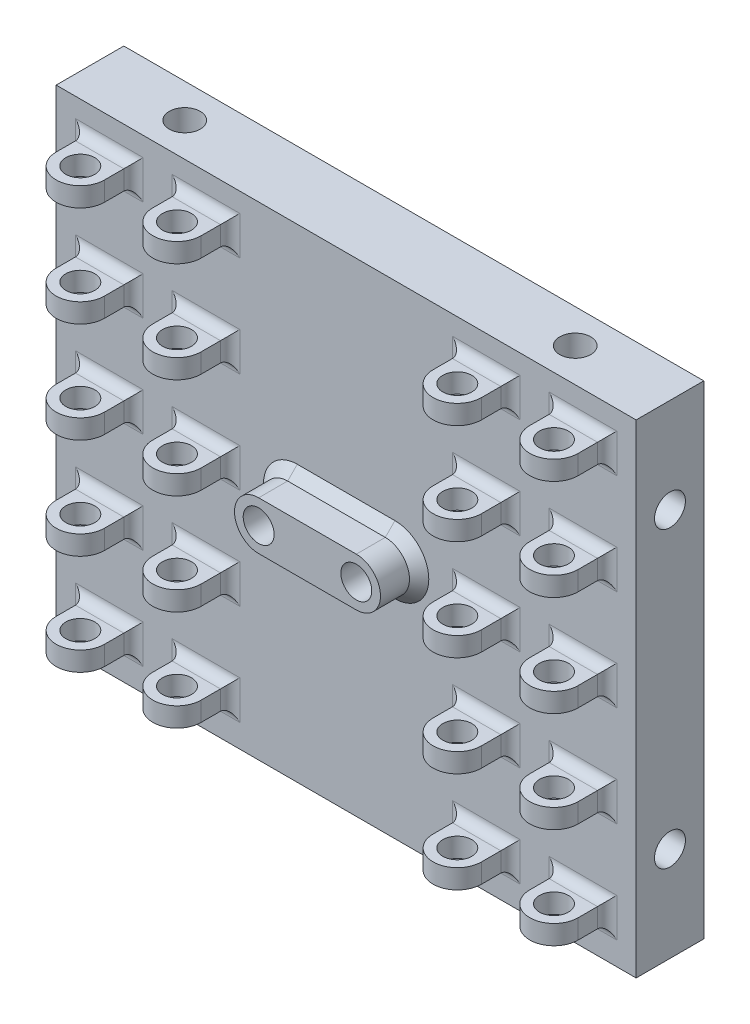
from build123d import *

# Parameters (mm, degrees)
SKETCH1_W               = 60
SKETCH1_H               = 50
BOSS_EXTRUDE1_DEPTH     = 7
BOSS_EXTRUDE2_DEPTH     = 4
SKETCH3_R               = 1.6
CUT_EXTRUDE1_DEPTH      = 41.57092555
CHAMFER1_SIZE           = 1
CUT_EXTRUDE2_DEPTH      = 4
SKETCH5_W               = 2.5
SKETCH5_H               = 5.6
CUT_EXTRUDE3_DEPTH      = 6.4
CUT_EXTRUDE4_START      = -6.4
SKETCH6_R               = 1.6
CUT_EXTRUDE4_DEPTH      = 11.4
MIRROR5_COPY_1_SKETCH_W = 2.5
MIRROR5_COPY_1_SKETCH_H = 5.6
MIRROR5_COPY_1_DEPTH    = 6.4
MIRROR5_START           = -6.4
MIRROR5_COPY_2_SKETCH_R = 1.6
MIRROR5_COPY_2_DEPTH    = 11.4
MIRROR6_START           = 20
MIRROR6_OUTLINE_W       = 5.6
MIRROR6_OUTLINE_H       = 6.4
MIRROR6_DEPTH           = 2.5
MIRROR6_START_2         = 17.5
MIRROR6_2_OUTLINE_R     = 1.6
MIRROR6_2_DEPTH         = 7.5
MIRROR6_START_3         = -27.5
MIRROR6_3_OUTLINE_W     = 5.6
MIRROR6_3_OUTLINE_H     = 6.4
MIRROR6_3_DEPTH         = 2.5
MIRROR6_START_4         = -30
MIRROR6_4_OUTLINE_R     = 1.6
MIRROR6_4_DEPTH         = 7.5
BOSS_EXTRUDE3_START     = -3
SKETCH7_R               = 1.5
BOSS_EXTRUDE3_DEPTH     = 2
FILLET1_R               = 1
LPATTERN1_COUNT         = 5
LPATTERN1_PITCH         = 10.4
LPATTERN1_COUNT_DIR2    = 2
LPATTERN1_PITCH_DIR2    = 10
FILLET1_OF_LPATTERN1_R  = 1
BOSS_EXTRUDE4_START     = -0.2
SKETCH8_R               = 1.6
BOSS_EXTRUDE4_DEPTH     = 0.2


# Read off the part's stored shape, not the designer's step: Mirror6, Mirror8
with BuildPart() as part:
    # Sketch1 → Boss-Extrude1 (new body)
    with BuildSketch(Plane.XY):
        Rectangle(SKETCH1_W, SKETCH1_H)
    extrude(amount=BOSS_EXTRUDE1_DEPTH)

    # Sketch2 → Boss-Extrude2 (add)
    with BuildSketch(Plane.XY.offset(7)):
        with BuildLine():
            Line((-5.05, 2.5), (5.05, 2.5))
            ThreePointArc((5.05, 2.5), (7.55, 0), (5.05, -2.5))
            Line((5.05, -2.5), (-5.05, -2.5))
            ThreePointArc((-5.05, -2.5), (-7.55, 0), (-5.05, 2.5))
        make_face()
    extrude(amount=BOSS_EXTRUDE2_DEPTH)

    # Sketch3 → Cut-Extrude1 (cut, through all)
    with BuildSketch(Plane.XY.offset(11)):
        with Locations((-5.05, 0)):
            Circle(SKETCH3_R)
        with Locations((5.05, 0)):
            Circle(SKETCH3_R)
    extrude(amount=-CUT_EXTRUDE1_DEPTH, mode=Mode.SUBTRACT)

    # Chamfer1
    chamfer1_edges = [part.edges().sort_by_distance(p)[0] for p in [
        (-7.55, 0, 7),
        (0, -2.5, 7),
        (7.55, 0, 7),
        (0, 2.5, 7),
    ]]
    chamfer(chamfer1_edges, length=CHAMFER1_SIZE)

    # Sketch4 → Cut-Extrude2 (cut)
    with BuildSketch(Plane(origin=(0, 0, 0), x_dir=(-1, 0, 0), z_dir=(0, 0, -1))):
        Polygon((-1.816838493, 0), (-3.433419246, 2.8), (-6.666580754, 2.8), (-8.283161507, 0), (-6.666580754, -2.8), (-3.433419246, -2.8), align=None)
        Polygon((1.816838493, 0), (3.433419246, -2.8), (6.666580754, -2.8), (8.283161507, 0), (6.666580754, 2.8), (3.433419246, 2.8), align=None)
    extrude(amount=-CUT_EXTRUDE2_DEPTH, mode=Mode.SUBTRACT)

    # Sketch5 → Cut-Extrude3 (cut)
    with BuildSketch(Plane(origin=(0, 0, 0), x_dir=(-1, 0, 0), z_dir=(0, 0, -1))):
        with Locations((-26.25, -15.2)):
            Rectangle(SKETCH5_W, SKETCH5_H)
    cut_extrude3 = extrude(amount=-CUT_EXTRUDE3_DEPTH, mode=Mode.SUBTRACT)

    # Sketch6 → Cut-Extrude4 (cut)
    with BuildSketch(Plane.ZY.offset(-27.5).offset(CUT_EXTRUDE4_START)):
        with Locations((3.5, -15.2)):
            Circle(SKETCH6_R)
    cut_extrude4 = extrude(amount=CUT_EXTRUDE4_DEPTH, mode=Mode.SUBTRACT)

    # Mirror1: Cut-Extrude3, Cut-Extrude4 across plane
    add(cut_extrude3.mirror(Plane.ZX), mode=Mode.SUBTRACT)
    add(cut_extrude4.mirror(Plane.ZX), mode=Mode.SUBTRACT)

    # Mirror4: Cut-Extrude3, Cut-Extrude4 across plane
    add(cut_extrude3.mirror(Plane(origin=(2.5, 2.5, 0), x_dir=(0, 0, 1), z_dir=(-0.7071067811865475, -0.7071067811865477, 0))), mode=Mode.SUBTRACT)
    add(cut_extrude4.mirror(Plane(origin=(2.5, 2.5, 0), x_dir=(0, 0, 1), z_dir=(-0.7071067811865475, -0.7071067811865477, 0))), mode=Mode.SUBTRACT)

    # Mirror5: Cut-Extrude3, Cut-Extrude4 across plane
    add(cut_extrude3.mirror(Plane(origin=(0, 0, 0), x_dir=(0, 0, 1), z_dir=(1, 0, 0))), mode=Mode.SUBTRACT)
    add(cut_extrude4.mirror(Plane(origin=(0, 0, 0), x_dir=(0, 0, 1), z_dir=(1, 0, 0))), mode=Mode.SUBTRACT)

    # Mirror5 copy 1 sketch → Mirror5 copy 1 (cut)
    with BuildSketch(Plane(origin=(-5, 5, 0), x_dir=(0, 1, 0), z_dir=(0, 0, -1))):
        with Locations((-26.25, -15.2)):
            Rectangle(MIRROR5_COPY_1_SKETCH_W, MIRROR5_COPY_1_SKETCH_H)
    extrude(amount=-MIRROR5_COPY_1_DEPTH, mode=Mode.SUBTRACT)

    # Mirror5 copy 2 sketch → Mirror5 copy 2 (cut)
    with BuildSketch(Plane(origin=(-5, -22.5, 0), x_dir=(0, 0, 1), z_dir=(0, 1, 0)).offset(MIRROR5_START)):
        with Locations((3.5, -15.2)):
            Circle(MIRROR5_COPY_2_SKETCH_R)
    extrude(amount=MIRROR5_COPY_2_DEPTH, mode=Mode.SUBTRACT)

    # Mirror6 outline → Mirror6 (cut)
    with BuildSketch(Plane(origin=(0, 0, 0), x_dir=(1, 0, 0), z_dir=(0, 1, 0)).offset(MIRROR6_START)):
        with Locations((20.2, -3.2)):
            Rectangle(MIRROR6_OUTLINE_W, MIRROR6_OUTLINE_H)
    mirror6 = extrude(amount=MIRROR6_DEPTH, mode=Mode.SUBTRACT)

    # Mirror6 2 outline → Mirror6 2 (cut)
    with BuildSketch(Plane(origin=(0, 0, 0), x_dir=(1, 0, 0), z_dir=(0, 1, 0)).offset(MIRROR6_START_2)):
        with Locations((20.2, -3.5)):
            Circle(MIRROR6_2_OUTLINE_R)
    mirror6_2 = extrude(amount=MIRROR6_2_DEPTH, mode=Mode.SUBTRACT)

    # Mirror6 3 outline → Mirror6 3 (cut)
    with BuildSketch(Plane.YZ.offset(MIRROR6_START_3)):
        with Locations((15.2, 3.2)):
            Rectangle(MIRROR6_3_OUTLINE_W, MIRROR6_3_OUTLINE_H)
    mirror6_3 = extrude(amount=MIRROR6_3_DEPTH, mode=Mode.SUBTRACT)

    # Mirror6 4 outline → Mirror6 4 (cut)
    with BuildSketch(Plane.YZ.offset(MIRROR6_START_4)):
        with Locations((15.2, 3.5)):
            Circle(MIRROR6_4_OUTLINE_R)
    mirror6_4 = extrude(amount=MIRROR6_4_DEPTH, mode=Mode.SUBTRACT)

    # Mirror7: Mirror6, Mirror6 2, Mirror6 3, Mirror6 4 across plane
    add(mirror6.mirror(Plane(origin=(0, 0, 0), x_dir=(0, 0, 1), z_dir=(1, 0, 0))), mode=Mode.SUBTRACT)
    add(mirror6_2.mirror(Plane(origin=(0, 0, 0), x_dir=(0, 0, 1), z_dir=(1, 0, 0))), mode=Mode.SUBTRACT)
    add(mirror6_3.mirror(Plane(origin=(0, 0, 0), x_dir=(0, 0, 1), z_dir=(1, 0, 0))), mode=Mode.SUBTRACT)
    add(mirror6_4.mirror(Plane(origin=(0, 0, 0), x_dir=(0, 0, 1), z_dir=(1, 0, 0))), mode=Mode.SUBTRACT)

    # Sketch7 → Boss-Extrude3 (add)
    with BuildSketch(Plane(origin=(0, 25, 0), x_dir=(1, 0, 0), z_dir=(0, 1, 0)).offset(BOSS_EXTRUDE3_START)):
        with BuildLine():
            Line((22, -7), (27, -7))
            Line((27, -7), (27, -10))
            ThreePointArc((27, -10), (24.5, -12.5), (22, -10))
            Line((22, -10), (22, -7))
        make_face()
        with Locations(Location((24.5, -10, 0), (0, 0, 270))):
            Circle(SKETCH7_R, mode=Mode.SUBTRACT)
    boss_extrude3 = extrude(amount=-BOSS_EXTRUDE3_DEPTH)

    # Fillet1
    fillet1_edges = [part.edges().sort_by_distance(p)[0] for p in [
        (24.5, 20, 7),
        (22, 21, 7),
        (27, 21, 7),
        (24.5, 22, 7),
    ]]
    fillet(fillet1_edges, radius=FILLET1_R)

    # LPattern1: Boss-Extrude3 5 × 2
    with Locations(*[(-j * LPATTERN1_PITCH_DIR2, -i * LPATTERN1_PITCH, 0) for i in range(LPATTERN1_COUNT) for j in range(LPATTERN1_COUNT_DIR2) if (i, j) != (0, 0)]):
        add(boss_extrude3)

    # Fillet1 of LPattern1
    fillet1_of_lpattern1_edges = [part.edges().sort_by_distance(p)[0] for p in [
        (14.5, 20, 7),
        (12, 21, 7),
        (17, 21, 7),
        (14.5, 22, 7),
        (24.5, 9.6, 7),
        (22, 10.6, 7),
        (27, 10.6, 7),
        (24.5, 11.6, 7),
        (14.5, 9.6, 7),
        (12, 10.6, 7),
        (17, 10.6, 7),
        (14.5, 11.6, 7),
        (24.5, -0.8, 7),
        (22, 0.2, 7),
        (27, 0.2, 7),
        (24.5, 1.2, 7),
        (14.5, -0.8, 7),
        (12, 0.2, 7),
        (17, 0.2, 7),
        (14.5, 1.2, 7),
        (24.5, -11.2, 7),
        (22, -10.2, 7),
        (27, -10.2, 7),
        (24.5, -9.2, 7),
        (14.5, -11.2, 7),
        (12, -10.2, 7),
        (17, -10.2, 7),
        (14.5, -9.2, 7),
        (24.5, -21.6, 7),
        (22, -20.6, 7),
        (27, -20.6, 7),
        (24.5, -19.6, 7),
        (14.5, -21.6, 7),
        (12, -20.6, 7),
        (17, -20.6, 7),
        (14.5, -19.6, 7),
    ]]
    fillet(fillet1_of_lpattern1_edges, radius=FILLET1_OF_LPATTERN1_R)

    # Mirror8: part across plane


with BuildPart() as part_1:
    add(part.part)
    add(part.part.mirror(Plane(origin=(0, 0, 0), x_dir=(0, 0, 1), z_dir=(1, 0, 0))))

    # Sketch8 → Boss-Extrude4 (add)
    with BuildSketch(Plane(origin=(0, 0, 4), x_dir=(-1, 0, 0), z_dir=(0, 0, -1)).offset(BOSS_EXTRUDE4_START)):
        with Locations(Location((5.05, 0, 0), (0, 0, 180))):
            Circle(SKETCH8_R)
        with Locations(Location((-5.05, 0, 0), (0, 0, 180))):
            Circle(SKETCH8_R)
    extrude(amount=BOSS_EXTRUDE4_DEPTH)


solid = part_1.part
